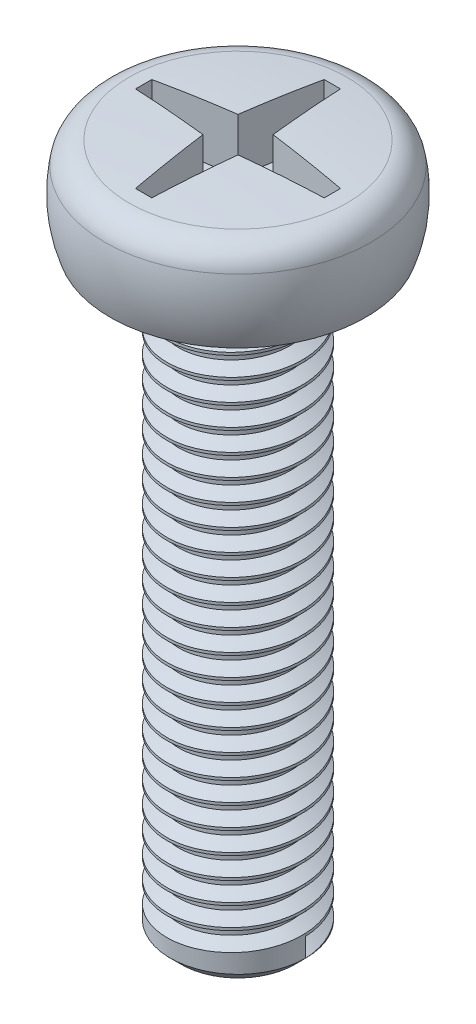
from build123d import *

# Parameters (mm, degrees)
FILLET1_R                 = 1
CUT_EXTRUDE1_REACH        = 11.89
CUT_EXTRUDE1_START_RADIUS = 44.099225113
CUT_EXTRUDE1_END_RADIUS   = 44.099225113
SKETCH3_R                 = 2.5
BOSS_EXTRUDE1_DEPTH       = 22
CHAMFER1_SIZE             = 0.4
THREAD1_PITCH             = 0.8


with BuildPart() as part:
    # Sketch1 → Revolve1 (revolve)
    with BuildSketch(Plane.XY):
        with BuildLine():
            Line((4.713877262, -0.272833551), (0, -0.272833551))
            Line((0, -0.272833551), (0, 3.227166449))
            ThreePointArc((0, 3.227166449), (2.360325965, 3.163955199), (4.713885409, 2.97450266))
            ThreePointArc((4.713885409, 2.97450266), (5, 1.350833837), (4.713877262, -0.272833551))
        make_face()
    revolve(axis=Axis((0, 3.227166449, 0), (0, -1, 0)))

    # Fillet1
    fillet1_edges = [part.edges().sort_by_distance(p)[0] for p in [
        (-4.713885409, 2.97450266, 0),
    ]]
    fillet(fillet1_edges, radius=FILLET1_R)

    # Cut-Extrude1: from a sphere face, 11.89 long prism both ways, kept between that surface and its translate by the depth
    cut_extrude1_start = Location((0, -40.872058664, 0)) * Sphere(CUT_EXTRUDE1_START_RADIUS, mode=Mode.PRIVATE)
    cut_extrude1_end = Location((0, -42.872058664, 0)) * Sphere(CUT_EXTRUDE1_END_RADIUS, mode=Mode.PRIVATE)
    # Sketch2 → Cut-Extrude1 (cut, from a surface)
    with BuildSketch(Plane.XZ.offset(0.272833551), mode=Mode.PRIVATE) as cut_extrude1_sk1:
        Polygon((-0.3, -3.485046478), (0.3, -3.485046478), (0.64729074, -0.64729074), (3.485046478, -0.3), (3.485046478, 0.3), (0.64729074, 0.64729074), (0.3, 3.485046478), (-0.3, 3.485046478), (-0.64729074, 0.64729074), (-3.485046478, 0.3), (-3.485046478, -0.3), (-0.64729074, -0.64729074), align=None)
    cut_extrude1_tool1 = extrude(cut_extrude1_sk1.sketch, amount=CUT_EXTRUDE1_REACH, both=True, mode=Mode.PRIVATE)
    add(((cut_extrude1_tool1 & cut_extrude1_start) - cut_extrude1_end).solids().sort_by_distance((0, 2.152942, 0))[0], mode=Mode.SUBTRACT)

    # Sketch3 → Boss-Extrude1 (add)
    with BuildSketch(Plane.XZ.offset(0.272833551)):
        Circle(SKETCH3_R)
    extrude(amount=BOSS_EXTRUDE1_DEPTH)

    # Chamfer1
    chamfer1_edges = [part.edges().sort_by_distance(p)[0] for p in [
        (-2.5, -22.272833551, 0),
    ]]
    chamfer(chamfer1_edges, length=CHAMFER1_SIZE)

    # Thread1: the profile of Thread Profile1 profile screwed along a right-hand helix of 25.75 turns, 8 arcs to a turn; built about Z, then put on its axis
    thread1_z = Axis((0, 0, 0), (0, 0, 1))
    thread1_corners = [(2.5003, 0, -0.000173205), (2.5003, 0, 0.700173203), (2.0669873, 0, 0.449999999), (2.0669873, 0, 0.249999999)]
    with BuildLine(mode=Mode.PRIVATE) as thread1_profile:
        Line(thread1_corners[0], thread1_corners[1])
        Line(thread1_corners[1], thread1_corners[2])
        Line(thread1_corners[2], thread1_corners[3])
        Line(thread1_corners[3], thread1_corners[0])
    thread1_cap = Face(thread1_profile.wire())
    thread1_turn_angles = [0, 22.5, 45, 67.5, 90, 112.5, 135, 157.5, 180, 202.5, 225, 247.5, 270, 292.5, 315, 337.5, 360]
    thread1_turn_weights = [1, 0.9238795325112867, 1, 0.9238795325112867, 1, 0.9238795325112867, 1, 0.9238795325112867, 1, 0.9238795325112867, 1, 0.9238795325112867, 1, 0.9238795325112867, 1, 0.9238795325112867, 1]
    thread1_turn_rails = [Edge.make_bspline([Vector(p[0], p[1], 0).rotate(thread1_z, thread1_turn_angles[k]) / thread1_turn_weights[k] + Vector(0, 0, p[2] + THREAD1_PITCH * thread1_turn_angles[k] / 360) for k in range(17)], [0, 0, 0, 1, 1, 2, 2, 3, 3, 4, 4, 5, 5, 6, 6, 7, 7, 8, 8, 8], 2, thread1_turn_weights) for p in thread1_corners]
    thread1_turn_sides = [Face.make_surface_from_curves(thread1_turn_rails[p[0]], thread1_turn_rails[p[1]]) for p in [(0, 1), (1, 2), (2, 3), (3, 0)]]
    thread1_turn = Solid(Shell([*thread1_turn_sides, thread1_cap, thread1_cap.rotate(thread1_z, 360).moved(Location((0, 0, THREAD1_PITCH * 360 / 360)))]))
    thread1_last_angles = [9000, 9022.5, 9045, 9067.5, 9090, 9112.5, 9135, 9157.5, 9180, 9202.5, 9225, 9247.5, 9270]
    thread1_last_weights = [1, 0.9238795325112867, 1, 0.9238795325112867, 1, 0.9238795325112867, 1, 0.9238795325112867, 1, 0.9238795325112867, 1, 0.9238795325112928, 1]
    thread1_last_rails = [Edge.make_bspline([Vector(p[0], p[1], 0).rotate(thread1_z, thread1_last_angles[k]) / thread1_last_weights[k] + Vector(0, 0, p[2] + THREAD1_PITCH * thread1_last_angles[k] / 360) for k in range(13)], [0, 0, 0, 1, 1, 2, 2, 3, 3, 4, 4, 5, 5, 6, 6, 6], 2, thread1_last_weights) for p in thread1_corners]
    thread1_last_sides = [Face.make_surface_from_curves(thread1_last_rails[p[0]], thread1_last_rails[p[1]]) for p in [(0, 1), (1, 2), (2, 3), (3, 0)]]
    thread1_last = Solid(Shell([*thread1_last_sides, thread1_cap.rotate(thread1_z, 9000).moved(Location((0, 0, THREAD1_PITCH * 9000 / 360))), thread1_cap.rotate(thread1_z, 9270).moved(Location((0, 0, THREAD1_PITCH * 9270 / 360)))]))
    thread1_each = [*[thread1_turn.moved(Location((0, 0, THREAD1_PITCH * i))) for i in range(25)], thread1_last]
    add(Plane(origin=(0, -21.872833551, 0), x_dir=(1, 0, 0), z_dir=(0, 1, 0)) * Compound([thread1_each[i] for i in range(0, 26, 2)]), mode=Mode.SUBTRACT)
    add(Plane(origin=(0, -21.872833551, 0), x_dir=(1, 0, 0), z_dir=(0, 1, 0)) * Compound([thread1_each[i] for i in range(1, 26, 2)]), mode=Mode.SUBTRACT)


solid = part.part
